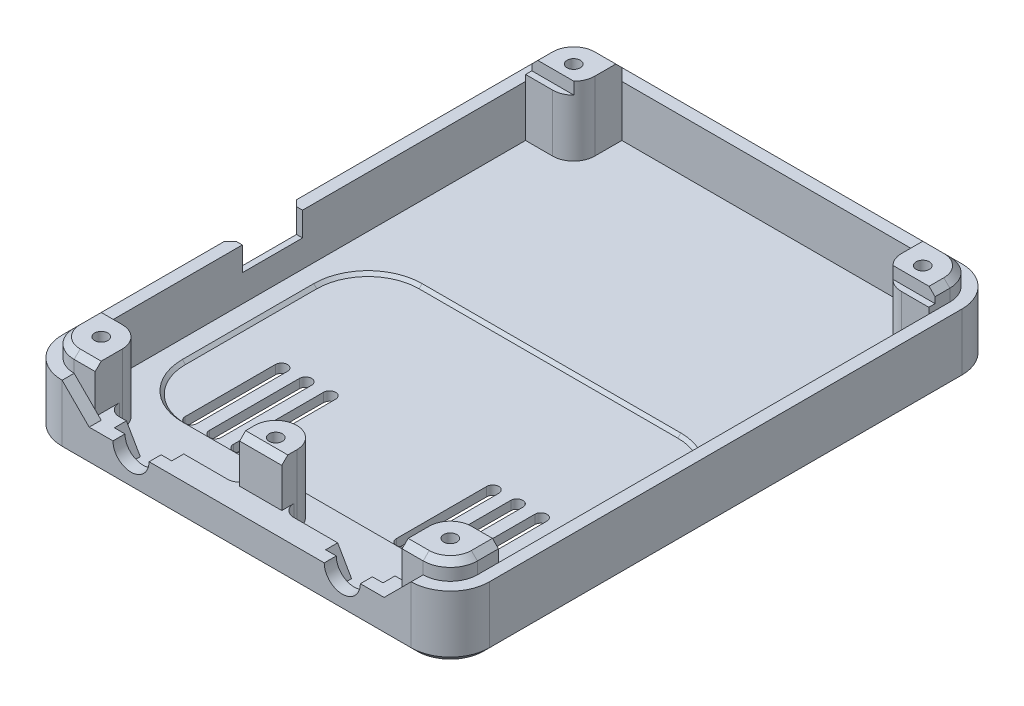
from build123d import *

# Parameters (mm, degrees)
BOSS_EXTRUDE1_DEPTH            = 10.5
BOSS_EXTRUDE2_DEPTH            = 2
BOSS_EXTRUDE4_DEPTH            = 11.5
BOSS_EXTRUDE6_REACH            = 65.208
CUT_EXTRUDE1_DEPTH             = 2
CUT_EXTRUDE2_REACH             = 89.912
SKETCH9_W                      = 10
SKETCH9_H                      = 4
CHAMFER1_SIZE                  = 1
CHAMFER2_SIZE                  = 1
BOSS_EXTRUDE7_DEPTH            = 2
SKETCH21_W                     = 67
SKETCH21_H                     = 1.043656047
CUT_EXTRUDE4_DEPTH             = 2
CUT_EXTRUDE5_DEPTH             = 0.5
CHAMFER4_SIZE                  = 1.5
CHAMFER5_SIZE                  = 1
CHAMFER6_SIZE                  = 1
CHAMFER7_SIZE                  = 1
F_2_2_2_2_DIAMETER_HOLE1_D     = 2.2
F_2_2_2_2_DIAMETER_HOLE1_DEPTH = 11.5
F_2_2_2_2_DIAMETER_HOLE1_TIP   = 0.660946681
SKETCH27_W                     = 7
SKETCH27_H                     = 2
CUT_EXTRUDE6_DEPTH             = 7.5
FILLET1_R                      = 2
CHAMFER8_SIZE                  = 1
CUT_EXTRUDE7_DEPTH             = 64.601942107


with BuildPart() as part:
    # Sketch2 → Boss-Extrude1 (new body)
    with BuildSketch(Plane(origin=(0, 0, 0), x_dir=(1, 0, 0), z_dir=(0, 1, 0))):
        with BuildLine():
            Line((-30.346153846, 41.446848386), (27.653846154, 41.446848386))
            ThreePointArc((27.653846154, 41.446848386), (32.250040232, 39.543042463), (34.153846154, 34.946848386))
            Line((34.153846154, 34.946848386), (34.153846154, -43.553151614))
            ThreePointArc((34.153846154, -43.553151614), (32.250040232, -48.149345692), (27.653846154, -50.053151614))
            Line((27.653846154, -50.053151614), (-30.346153846, -50.053151614))
            ThreePointArc((-30.346153846, -50.053151614), (-34.942347924, -48.149345692), (-36.846153846, -43.553151614))
            Line((-36.846153846, -43.553151614), (-36.846153846, 34.946848386))
            ThreePointArc((-36.846153846, 34.946848386), (-34.942347924, 39.543042463), (-30.346153846, 41.446848386))
        make_face()
        with BuildLine():
            Line((-30.346153846, 39.446848386), (27.653846154, 39.446848386))
            ThreePointArc((27.653846154, 39.446848386), (30.835826669, 38.128828901), (32.153846154, 34.946848386))
            Line((32.153846154, 34.946848386), (32.153846154, -43.553151614))
            ThreePointArc((32.153846154, -43.553151614), (30.835826669, -46.73513213), (27.653846154, -48.053151614))
            Line((27.653846154, -48.053151614), (-30.346153846, -48.053151614))
            ThreePointArc((-30.346153846, -48.053151614), (-33.528134361, -46.73513213), (-34.846153846, -43.553151614))
            Line((-34.846153846, -43.553151614), (-34.846153846, 34.946848386))
            ThreePointArc((-34.846153846, 34.946848386), (-33.528134361, 38.128828901), (-30.346153846, 39.446848386))
        make_face(mode=Mode.SUBTRACT)
    extrude(amount=BOSS_EXTRUDE1_DEPTH)

    # Sketch3 → Boss-Extrude2 (add)
    with BuildSketch(Plane(origin=(0, 0, 0), x_dir=(1, 0, 0), z_dir=(0, 1, 0))):
        with BuildLine():
            Line((-30.346153846, -48.053151614), (27.653846154, -48.053151614))
            ThreePointArc((27.653846154, -48.053151614), (30.835826669, -46.73513213), (32.153846154, -43.553151614))
            Line((32.153846154, -43.553151614), (32.153846154, 34.946848386))
            ThreePointArc((32.153846154, 34.946848386), (30.835826669, 38.128828901), (27.653846154, 39.446848386))
            Line((27.653846154, 39.446848386), (-30.346153846, 39.446848386))
            ThreePointArc((-30.346153846, 39.446848386), (-33.528134361, 38.128828901), (-34.846153846, 34.946848386))
            Line((-34.846153846, 34.946848386), (-34.846153846, -43.553151614))
            ThreePointArc((-34.846153846, -43.553151614), (-33.528134361, -46.73513213), (-30.346153846, -48.053151614))
        make_face()
    extrude(amount=BOSS_EXTRUDE2_DEPTH)

    # Sketch6 → Boss-Extrude4 (add)
    with BuildSketch(Plane(origin=(0, 2, 0), x_dir=(1, 0, 0), z_dir=(0, 1, 0))):
        with BuildLine():
            Line((-26.846153846, 34.946848386), (-26.846153846, 39.446848386))
            Line((-26.846153846, 39.446848386), (-30.346153846, 39.446848386))
            ThreePointArc((-30.346153846, 39.446848386), (-33.528134361, 38.128828901), (-34.846153846, 34.946848386))
            Line((-34.846153846, 34.946848386), (-34.846153846, 31.446848386))
            Line((-34.846153846, 31.446848386), (-30.346153846, 31.446848386))
            ThreePointArc((-30.346153846, 31.446848386), (-27.871280112, 32.471974652), (-26.846153846, 34.946848386))
        make_face()
        with BuildLine():
            Line((24.153846154, 34.946848386), (24.153846154, 39.446848386))
            Line((24.153846154, 39.446848386), (27.653846154, 39.446848386))
            ThreePointArc((27.653846154, 39.446848386), (30.835826669, 38.128828901), (32.153846154, 34.946848386))
            Line((32.153846154, 34.946848386), (32.153846154, 31.446848386))
            Line((32.153846154, 31.446848386), (27.653846154, 31.446848386))
            ThreePointArc((27.653846154, 31.446848386), (25.17897242, 32.471974652), (24.153846154, 34.946848386))
        make_face()
    extrude(amount=BOSS_EXTRUDE4_DEPTH)

    # Boss-Extrude6: up to this face of the body (flat: up to its plane)
    boss_extrude6_end = Plane(part.part.faces().sort_by_distance((-30.766287969, 13.5, -35.366982508))[0])
    # Sketch8 → Boss-Extrude6 (add, up to the picked face)
    with BuildSketch(Plane(origin=(0, 2, 0), x_dir=(1, 0, 0), z_dir=(0, 1, 0)), mode=Mode.PRIVATE) as boss_extrude6_sk1:
        with BuildLine():
            Line((-4.846153846, -43.553151614), (-4.846153846, -48.053151614))
            Line((-4.846153846, -48.053151614), (2.153846154, -48.053151614))
            Line((2.153846154, -48.053151614), (2.153846154, -43.553151614))
            ThreePointArc((2.153846154, -43.553151614), (-1.346153846, -40.053151614), (-4.846153846, -43.553151614))
        make_face()
    boss_extrude6_tool1 = split(extrude(boss_extrude6_sk1.sketch, amount=BOSS_EXTRUDE6_REACH, mode=Mode.PRIVATE), bisect_by=boss_extrude6_end, keep=Keep.BOTH, mode=Mode.PRIVATE)
    # Sketch8 → Boss-Extrude6 (add, up to the picked face)
    with BuildSketch(Plane(origin=(0, 2, 0), x_dir=(1, 0, 0), z_dir=(0, 1, 0)), mode=Mode.PRIVATE) as boss_extrude6_sk2:
        with BuildLine():
            Line((32.153846154, -40.053151614), (32.153846154, -43.553151614))
            ThreePointArc((32.153846154, -43.553151614), (30.835826669, -46.73513213), (27.653846154, -48.053151614))
            Line((27.653846154, -48.053151614), (24.153846154, -48.053151614))
            Line((24.153846154, -48.053151614), (24.153846154, -43.553151614))
            ThreePointArc((24.153846154, -43.553151614), (25.17897242, -41.07827788), (27.653846154, -40.053151614))
            Line((27.653846154, -40.053151614), (32.153846154, -40.053151614))
        make_face()
    boss_extrude6_tool2 = split(extrude(boss_extrude6_sk2.sketch, amount=BOSS_EXTRUDE6_REACH, mode=Mode.PRIVATE), bisect_by=boss_extrude6_end, keep=Keep.BOTH, mode=Mode.PRIVATE)
    # Sketch8 → Boss-Extrude6 (add, up to the picked face)
    with BuildSketch(Plane(origin=(0, 2, 0), x_dir=(1, 0, 0), z_dir=(0, 1, 0)), mode=Mode.PRIVATE) as boss_extrude6_sk3:
        with BuildLine():
            Line((-34.846153846, -40.053151614), (-34.846153846, -43.553151614))
            ThreePointArc((-34.846153846, -43.553151614), (-33.528134361, -46.73513213), (-30.346153846, -48.053151614))
            Line((-30.346153846, -48.053151614), (-26.846153846, -48.053151614))
            Line((-26.846153846, -48.053151614), (-26.846153846, -43.553151614))
            ThreePointArc((-26.846153846, -43.553151614), (-27.871280112, -41.07827788), (-30.346153846, -40.053151614))
            Line((-30.346153846, -40.053151614), (-34.846153846, -40.053151614))
        make_face()
    boss_extrude6_tool3 = split(extrude(boss_extrude6_sk3.sketch, amount=BOSS_EXTRUDE6_REACH, mode=Mode.PRIVATE), bisect_by=boss_extrude6_end, keep=Keep.BOTH, mode=Mode.PRIVATE)
    add(boss_extrude6_tool1.solids().sort_by(Axis((-1.346154, 2, 44.386612), (0, 1, 0)))[0])
    add(boss_extrude6_tool2.solids().sort_by(Axis((28.07398, 2, 43.973286), (0, 1, 0)))[0])
    add(boss_extrude6_tool3.solids().sort_by(Axis((-30.766288, 2, 43.973286), (0, 1, 0)))[0])

    # Sketch7 → Cut-Extrude1 (cut)
    with BuildSketch(Plane.XY.offset(50.053151614)):
        with BuildLine():
            Line((27.653846154, 10.5), (-30.346153846, 10.5))
            Line((-30.346153846, 10.5), (-25.846153846, 6))
            Line((-25.846153846, 6), (-21.89693017, 6))
            ThreePointArc((-21.89693017, 6), (-18.89693017, 3), (-15.89693017, 6))
            Line((-15.89693017, 6), (13.204622477, 6))
            ThreePointArc((13.204622477, 6), (16.204622477, 3), (19.204622477, 6))
            Line((19.204622477, 6), (23.153846154, 6))
            Line((23.153846154, 6), (27.653846154, 10.5))
        make_face()
    extrude(amount=-CUT_EXTRUDE1_DEPTH, mode=Mode.SUBTRACT)

    # Sketch9 → Cut-Extrude2 (cut, up to next)
    with BuildSketch(Plane.ZY.offset(36.846153846), mode=Mode.PRIVATE) as cut_extrude2_sk1:
        with Locations((10.611298715, 8.5)):
            Rectangle(SKETCH9_W, SKETCH9_H)
    cut_extrude2_tool1 = extrude(cut_extrude2_sk1.sketch, amount=-CUT_EXTRUDE2_REACH, mode=Mode.PRIVATE) & part.part
    add(cut_extrude2_tool1.solids().sort_by_distance((-36.846154, 8.5, 10.611299))[0], mode=Mode.SUBTRACT)

    # Chamfer1
    chamfer1_edges = [part.edges().sort_by_distance(p)[0] for p in [
        (-36.846153846, 8.5, 5.611298715),
        (-36.846153846, 6.5, 10.611298715),
        (-36.846153846, 8.5, 15.611298715),
    ]]
    chamfer(chamfer1_edges, length=CHAMFER1_SIZE)

    # Chamfer2
    chamfer2_edges = [part.edges().sort_by_distance(p)[0] for p in [
        (-36.846153846, 0, 4.303151614),
        (-34.942347924, 0, -39.543042463),
        (-1.346153846, 0, -41.446848386),
        (32.250040232, 0, -39.543042463),
        (34.153846154, 0, 4.303151614),
        (32.250040232, 0, 48.149345692),
        (-1.346153846, 0, 50.053151614),
        (-34.942347924, 0, 48.149345692),
    ]]
    chamfer(chamfer2_edges, length=CHAMFER2_SIZE)

    # Sketch19 → Boss-Extrude7 (add)
    with BuildSketch(Plane(origin=(0, 0, 48.053151614), x_dir=(-1, 0, 0), z_dir=(0, 0, -1))):
        Polygon((26.846153846, 6), (23.660734993, 6), (21.351333916, 2), (26.846153846, 2), align=None)
        Polygon((4.846153846, 2), (16.442526423, 2), (14.133125347, 6), (4.846153846, 6), align=None)
        Polygon((-13.750218731, 2), (-2.153846154, 2), (-2.153846154, 6), (-11.440817654, 6), align=None)
        Polygon((-24.153846154, 2), (-18.659026224, 2), (-20.968427301, 6), (-24.153846154, 6), align=None)
    extrude(amount=BOSS_EXTRUDE7_DEPTH)

    # Sketch21 → Cut-Extrude4 (cut)
    with BuildSketch(Plane(origin=(0, 13.5, 0), x_dir=(1, 0, 0), z_dir=(0, 1, 0))):
        with Locations((-1.346153846, 31.96867641)):
            Rectangle(SKETCH21_W, SKETCH21_H)
    extrude(amount=-CUT_EXTRUDE4_DEPTH, mode=Mode.SUBTRACT)

    # Sketch22 → Cut-Extrude5 (cut)
    with BuildSketch(Plane(origin=(0, 2, 0), x_dir=(1, 0, 0), z_dir=(0, 1, 0))):
        with BuildLine():
            Line((-22.846153846, 3.259423313), (20.153846154, 3.259423313))
            ThreePointArc((20.153846154, 3.259423313), (27.224913966, 0.330491125), (30.153846154, -6.740576687))
            Line((30.153846154, -6.740576687), (30.153846154, -28.568151594))
            ThreePointArc((30.153846154, -28.568151594), (27.224913966, -35.639219406), (20.153846154, -38.568151594))
            Line((20.153846154, -38.568151594), (-22.846153846, -38.568151594))
            ThreePointArc((-22.846153846, -38.568151594), (-29.917221658, -35.639219406), (-32.846153846, -28.568151594))
            Line((-32.846153846, -28.568151594), (-32.846153846, -6.740576687))
            ThreePointArc((-32.846153846, -6.740576687), (-29.917221658, 0.330491125), (-22.846153846, 3.259423313))
        make_face()
    extrude(amount=-CUT_EXTRUDE5_DEPTH, mode=Mode.SUBTRACT)

    # Chamfer4
    # the kernel refuses this chamfer: 1.5 mm, written as the material it adds along each edge
    with BuildSketch(Plane(origin=(20.153846154, 1.5, 38.568151594), x_dir=(0, 0.9996219169112968, 0.027495876610586775), z_dir=(-1, 0, 0))) as chamfer4_piece_1_section:
        Polygon((CHAMFER4_SIZE * 0.999621916911, CHAMFER4_SIZE * 0.0274958766106), (-CHAMFER4_SIZE * 0.0274958766106, CHAMFER4_SIZE * 0.999621916911), (0, 0), align=None)
    chamfer4_piece_1 = extrude(amount=43, mode=Mode.PRIVATE)
    chamfer4_piece_1 = split(chamfer4_piece_1, bisect_by=Plane(origin=(-1.346153846, 2, 37.925091261), z_dir=(0, -1, 0)), keep=Keep.TOP, mode=Mode.PRIVATE)
    add(chamfer4_piece_1)
    with BuildSketch(Plane(origin=(20.153846154, 1.5, 28.568151594), x_dir=(1, 0, 0), z_dir=(0, 0, -1))) as chamfer4_piece_2_section:
        Polygon((10, -CHAMFER4_SIZE), (10 - CHAMFER4_SIZE, 0), (10, 0), align=None)
    chamfer4_piece_2 = revolve(axis=Axis((20.153846154, 1.5, 28.568151594), (0, -1, 0)), revolution_arc=90, mode=Mode.PRIVATE)
    chamfer4_piece_2 = split(chamfer4_piece_2, bisect_by=Plane(origin=(26.336878158, 2, 34.751183598), z_dir=(0, -1, 0)), keep=Keep.TOP, mode=Mode.PRIVATE)
    add(chamfer4_piece_2)
    with BuildSketch(Plane(origin=(-22.846153846, 1.5, 28.568151594), x_dir=(0, 0, 1), z_dir=(1, 0, 0))) as chamfer4_piece_3_section:
        Polygon((10, -CHAMFER4_SIZE), (10 - CHAMFER4_SIZE, 0), (10, 0), align=None)
    chamfer4_piece_3 = revolve(axis=Axis((-22.846153846, 1.5, 28.568151594), (0, -1, 0)), revolution_arc=90, mode=Mode.PRIVATE)
    chamfer4_piece_3 = split(chamfer4_piece_3, bisect_by=Plane(origin=(-29.02918585, 2, 34.751183598), z_dir=(0, -1, 0)), keep=Keep.TOP, mode=Mode.PRIVATE)
    add(chamfer4_piece_3)
    with BuildSketch(Plane(origin=(30.153846154, 1.5, 6.740576687), x_dir=(0.027495876610586775, 0.9996219169112968, 0), z_dir=(0, 0, 1))) as chamfer4_piece_4_section:
        Polygon((CHAMFER4_SIZE * 0.999621916911, CHAMFER4_SIZE * 0.0274958766106), (-CHAMFER4_SIZE * 0.0274958766106, CHAMFER4_SIZE * 0.999621916911), (0, 0), align=None)
    chamfer4_piece_4 = extrude(amount=21.827574907, mode=Mode.PRIVATE)
    chamfer4_piece_4 = split(chamfer4_piece_4, bisect_by=Plane(origin=(29.51078582, 2, 17.654364141), z_dir=(0, -1, 0)), keep=Keep.TOP, mode=Mode.PRIVATE)
    add(chamfer4_piece_4)
    with BuildSketch(Plane(origin=(-32.846153846, 1.5, 28.568151594), x_dir=(-0.027495876610586775, 0.9996219169112968, 0), z_dir=(0, 0, -1))) as chamfer4_piece_5_section:
        Polygon((CHAMFER4_SIZE * 0.999621916911, CHAMFER4_SIZE * 0.0274958766106), (-CHAMFER4_SIZE * 0.0274958766106, CHAMFER4_SIZE * 0.999621916911), (0, 0), align=None)
    chamfer4_piece_5 = extrude(amount=21.827574907, mode=Mode.PRIVATE)
    chamfer4_piece_5 = split(chamfer4_piece_5, bisect_by=Plane(origin=(-32.203093513, 2, 17.654364141), z_dir=(0, -1, 0)), keep=Keep.TOP, mode=Mode.PRIVATE)
    add(chamfer4_piece_5)
    with BuildSketch(Plane(origin=(20.153846154, 1.5, 6.740576687), x_dir=(0, 0, -1), z_dir=(-1, 0, 0))) as chamfer4_piece_6_section:
        Polygon((10, -CHAMFER4_SIZE), (10 - CHAMFER4_SIZE, 0), (10, 0), align=None)
    chamfer4_piece_6 = revolve(axis=Axis((20.153846154, 1.5, 6.740576687), (0, -1, 0)), revolution_arc=90, mode=Mode.PRIVATE)
    chamfer4_piece_6 = split(chamfer4_piece_6, bisect_by=Plane(origin=(26.336878158, 2, 0.557544683), z_dir=(0, -1, 0)), keep=Keep.TOP, mode=Mode.PRIVATE)
    add(chamfer4_piece_6)
    with BuildSketch(Plane(origin=(-22.846153846, 1.5, 6.740576687), x_dir=(-1, 0, 0), z_dir=(0, 0, 1))) as chamfer4_piece_7_section:
        Polygon((10, -CHAMFER4_SIZE), (10 - CHAMFER4_SIZE, 0), (10, 0), align=None)
    chamfer4_piece_7 = revolve(axis=Axis((-22.846153846, 1.5, 6.740576687), (0, -1, 0)), revolution_arc=90, mode=Mode.PRIVATE)
    chamfer4_piece_7 = split(chamfer4_piece_7, bisect_by=Plane(origin=(-29.02918585, 2, 0.557544683), z_dir=(0, -1, 0)), keep=Keep.TOP, mode=Mode.PRIVATE)
    add(chamfer4_piece_7)
    with BuildSketch(Plane(origin=(-22.846153846, 1.5, -3.259423313), x_dir=(0, 0.9996219169112969, -0.02749587661058649), z_dir=(1, 0, 0))) as chamfer4_piece_8_section:
        Polygon((CHAMFER4_SIZE * 0.999621916911, CHAMFER4_SIZE * 0.0274958766106), (-CHAMFER4_SIZE * 0.0274958766106, CHAMFER4_SIZE * 0.999621916911), (0, 0), align=None)
    chamfer4_piece_8 = extrude(amount=43, mode=Mode.PRIVATE)
    chamfer4_piece_8 = split(chamfer4_piece_8, bisect_by=Plane(origin=(-1.346153846, 2, -2.616362979), z_dir=(0, -1, 0)), keep=Keep.TOP, mode=Mode.PRIVATE)
    add(chamfer4_piece_8)

    # Chamfer5
    chamfer5_edges = [part.edges().sort_by_distance(p)[0] for p in [
        (32.153846154, 13.5, -33.718676409),
        (30.835826669, 13.5, -38.128828901),
        (25.903846154, 13.5, -39.446848386),
    ]]
    chamfer(chamfer5_edges, length=CHAMFER5_SIZE)

    # Chamfer6
    chamfer6_edges = [part.edges().sort_by_distance(p)[0] for p in [
        (-28.596153846, 13.5, -39.446848386),
        (-33.528134361, 13.5, -38.128828901),
        (-34.846153846, 13.5, -33.718676409),
    ]]
    chamfer(chamfer6_edges, length=CHAMFER6_SIZE)

    # Chamfer7
    chamfer7_edges = [part.edges().sort_by_distance(p)[0] for p in [
        (25.903846154, 13.5, 48.053151614),
        (30.835826669, 13.5, 46.73513213),
        (32.153846154, 13.5, 41.803151614),
        (-34.846153846, 13.5, 41.803151614),
        (-33.528134361, 13.5, 46.73513213),
        (-28.596153846, 13.5, 48.053151614),
    ]]
    chamfer(chamfer7_edges, length=CHAMFER7_SIZE)

    # Ø2.2 (2.2) Diameter Hole1
    with Locations(Plane(origin=(0, 13.5, 0), x_dir=(1, 0, 0), z_dir=(0, 1, 0))):
        with Locations((-30.346153846, -43.553151614), (27.653846154, -43.553151614), (27.653846154, 34.946848386), (-30.346153846, 34.946848386), (-1.346153846, -43.553151614)):
            Hole(F_2_2_2_2_DIAMETER_HOLE1_D / 2, depth=F_2_2_2_2_DIAMETER_HOLE1_DEPTH)
            with Locations((0, 0, -(F_2_2_2_2_DIAMETER_HOLE1_DEPTH + F_2_2_2_2_DIAMETER_HOLE1_TIP / 2))):  # 118° drill point
                Cone(0, F_2_2_2_2_DIAMETER_HOLE1_D / 2, F_2_2_2_2_DIAMETER_HOLE1_TIP, mode=Mode.SUBTRACT)

    # Sketch27 → Cut-Extrude6 (cut)
    with BuildSketch(Plane(origin=(0, 13.5, 0), x_dir=(1, 0, 0), z_dir=(0, 1, 0))):
        with Locations((-1.346153846, -47.053151614)):
            Rectangle(SKETCH27_W, SKETCH27_H)
    extrude(amount=-CUT_EXTRUDE6_DEPTH, mode=Mode.SUBTRACT)

    # Fillet1
    fillet1_edges = [part.edges().sort_by_distance(p)[0] for p in [
        (24.153846154, 4, 46.053151614),
        (-26.846153846, 4, 46.053151614),
        (2.153846154, 4, 46.053151614),
        (-4.846153846, 4, 46.053151614),
    ]]
    fillet(fillet1_edges, radius=FILLET1_R)

    # Chamfer8
    chamfer8_edges = [part.edges().sort_by_distance(p)[0] for p in [
        (-1.346153846, 13.5, 46.053151614),
    ]]
    chamfer(chamfer8_edges, length=CHAMFER8_SIZE)

    # Sketch28 → Cut-Extrude7 (cut, through all)
    with BuildSketch(Plane.XZ):
        with BuildLine():
            Line((-17.89693017, 36.053151614), (-17.89693017, 21.053151614))
            ThreePointArc((-17.89693017, 21.053151614), (-18.89693017, 20.053151614), (-19.89693017, 21.053151614))
            Line((-19.89693017, 21.053151614), (-19.89693017, 36.053151614))
            ThreePointArc((-19.89693017, 36.053151614), (-18.89693017, 37.053151614), (-17.89693017, 36.053151614))
        make_face()
        with BuildLine():
            Line((-21.89693017, 36.053151614), (-21.89693017, 21.053151614))
            ThreePointArc((-21.89693017, 21.053151614), (-22.89693017, 20.053151614), (-23.89693017, 21.053151614))
            Line((-23.89693017, 21.053151614), (-23.89693017, 36.053151614))
            ThreePointArc((-23.89693017, 36.053151614), (-22.89693017, 37.053151614), (-21.89693017, 36.053151614))
        make_face()
        with BuildLine():
            Line((-13.89693017, 36.053151614), (-13.89693017, 21.053151614))
            ThreePointArc((-13.89693017, 21.053151614), (-14.89693017, 20.053151614), (-15.89693017, 21.053151614))
            Line((-15.89693017, 21.053151614), (-15.89693017, 36.053151614))
            ThreePointArc((-15.89693017, 36.053151614), (-14.89693017, 37.053151614), (-13.89693017, 36.053151614))
        make_face()
        with BuildLine():
            Line((17.204622477, 36.053151614), (17.204622477, 21.053151614))
            ThreePointArc((17.204622477, 21.053151614), (16.204622477, 20.053151614), (15.204622477, 21.053151614))
            Line((15.204622477, 21.053151614), (15.204622477, 36.053151614))
            ThreePointArc((15.204622477, 36.053151614), (16.204622477, 37.053151614), (17.204622477, 36.053151614))
        make_face()
        with BuildLine():
            Line((13.204622477, 36.053151614), (13.204622477, 21.053151614))
            ThreePointArc((13.204622477, 21.053151614), (12.204622477, 20.053151614), (11.204622477, 21.053151614))
            Line((11.204622477, 21.053151614), (11.204622477, 36.053151614))
            ThreePointArc((11.204622477, 36.053151614), (12.204622477, 37.053151614), (13.204622477, 36.053151614))
        make_face()
        with BuildLine():
            Line((21.204622477, 36.053151614), (21.204622477, 21.053151614))
            ThreePointArc((21.204622477, 21.053151614), (20.204622477, 20.053151614), (19.204622477, 21.053151614))
            Line((19.204622477, 21.053151614), (19.204622477, 36.053151614))
            ThreePointArc((19.204622477, 36.053151614), (20.204622477, 37.053151614), (21.204622477, 36.053151614))
        make_face()
    extrude(amount=-CUT_EXTRUDE7_DEPTH, mode=Mode.SUBTRACT)


solid = part.part
